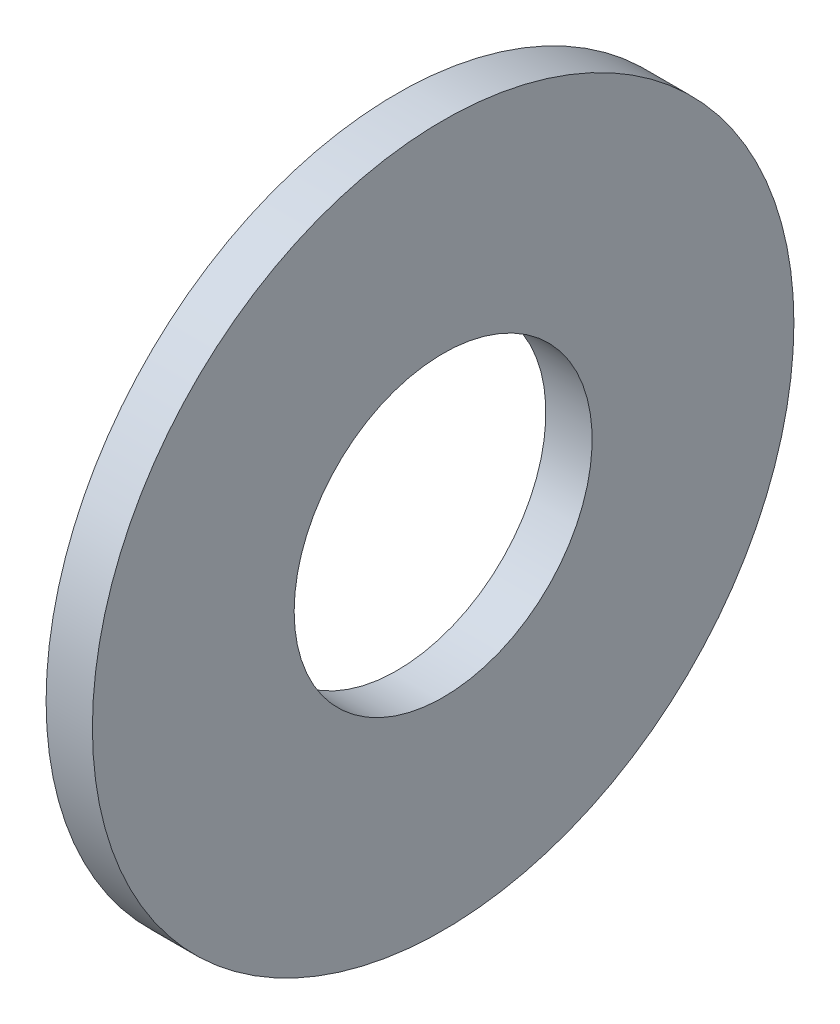
from build123d import *

# Parameters (mm, degrees)
SKETCH1_W = 4.191
SKETCH1_H = 18.2626


with BuildPart() as part:
    # Sketch1 → Base-Revolve (revolve)
    with BuildSketch(Plane.XY):
        with Locations((-2.0955, 22.6187)):
            Rectangle(SKETCH1_W, SKETCH1_H)
    revolve(axis=Axis((-34.925, 0, 0), (1, 0, 0)))


solid = part.part
